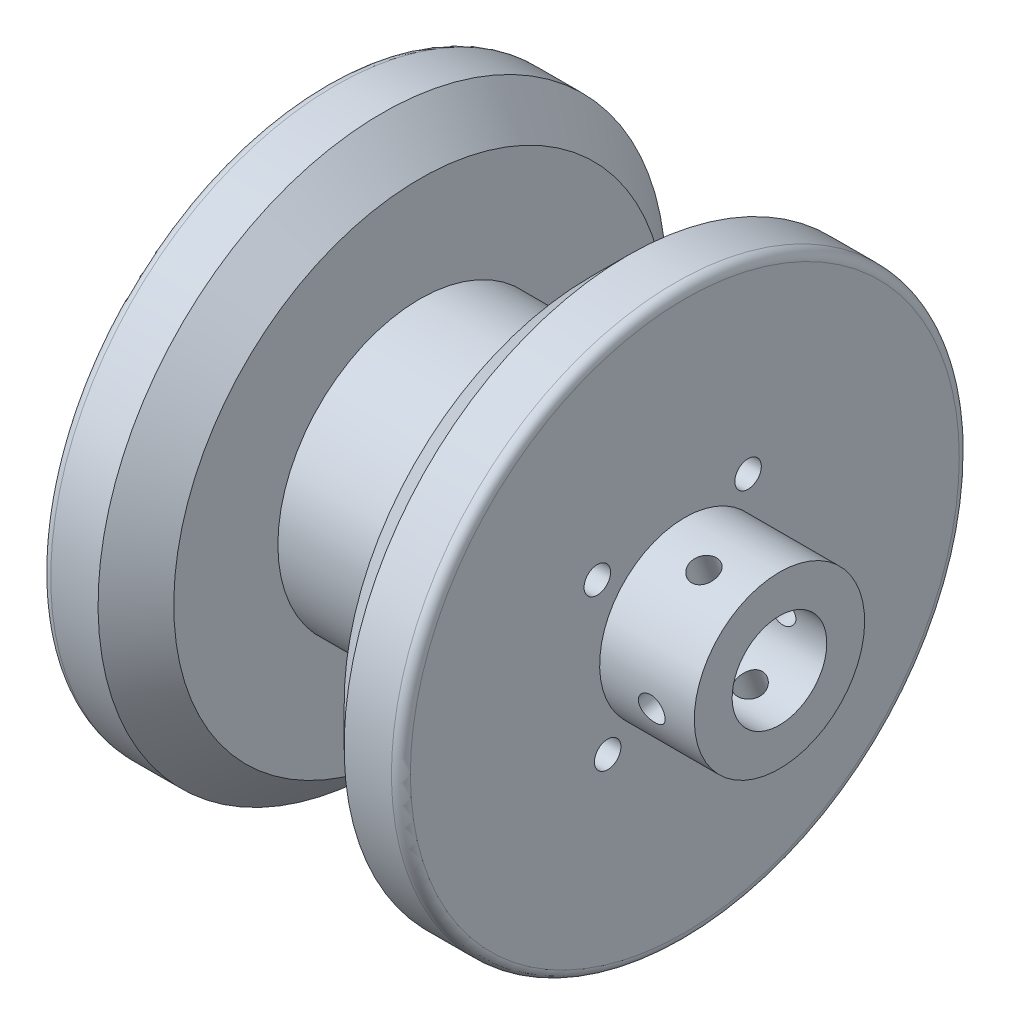
from build123d import *

# Parameters (mm, degrees)
SKETCH2_R                           = 9
BOSS_EXTRUDE1_DEPTH                 = 10
SKETCH3_R                           = 5
CUT_EXTRUDE1_DEPTH                  = 65.062469512
F_1_0MM_DOWEL_HOLE1_D               = 2.8
F_1_0MM_DOWEL_HOLE1_DEPTH           = 33.158795133
F_1_0MM_DOWEL_HOLE1_TIP             = 0.841204867
F_1_0MM_DOWEL_HOLE1_ON_FACE_2_D     = 2.8
F_1_0MM_DOWEL_HOLE1_ON_FACE_2_DEPTH = 33.158795133
F_1_0MM_DOWEL_HOLE1_ON_FACE_2_TIP   = 0.841204867
CHAMFER1_SIZE                       = 4
FILLET4_R                           = 1
CUT_EXTRUDE2_DEPTH                  = 52.390660687
CUT_EXTRUDE2_DEPTH_BACK             = 52.390660687
SKETCH5_W                           = 0.1
SKETCH5_H                           = 54.545123527
F_1_0MM_DOWEL_HOLE2_AT_2_COUNT      = 2
F_1_0MM_DOWEL_HOLE2_AT_2_PITCH      = 17.915817011
F_1_0MM_DOWEL_HOLE2_AT_3_COUNT      = 2
F_1_0MM_DOWEL_HOLE2_AT_3_PITCH      = 23.513798967
F_1_0MM_DOWEL_HOLE2_AT_4_COUNT      = 2
F_1_0MM_DOWEL_HOLE2_AT_4_PITCH      = 16.022789911


with BuildPart() as part:
    # Sketch1 → Revolve1 (revolve)
    with BuildSketch(Plane.XY):
        Polygon((-19, 0), (19, 0), (19, 30), (9, 30), (9, 15), (-9, 15), (-9, 30), (-19, 30), align=None)
    revolve(axis=Axis((-19, 0, 0), (1, 0, 0)))

    # Sketch2 → Boss-Extrude1 (add)
    with BuildSketch(Plane(origin=(19, 0, 0), x_dir=(0, 0, -1), z_dir=(1, 0, 0))):
        Circle(SKETCH2_R)
    extrude(amount=BOSS_EXTRUDE1_DEPTH)

    # Sketch3 → Cut-Extrude1 (cut, through all)
    with BuildSketch(Plane(origin=(29, 0, 0), x_dir=(0, 0, -1), z_dir=(1, 0, 0))):
        Circle(SKETCH3_R)
    extrude(amount=-CUT_EXTRUDE1_DEPTH, mode=Mode.SUBTRACT)

    # Ø1.0mm Dowel Hole1
    with Locations(Plane(origin=(24.178674036, 8.421026655, 3.175895162), x_dir=(0, -0.352877240247, 0.935669628296), z_dir=(0, 0.935669628296, 0.352877240247))):
        with Locations((0, 0)):
            Hole(F_1_0MM_DOWEL_HOLE1_D / 2, depth=F_1_0MM_DOWEL_HOLE1_DEPTH)
            with Locations((0, 0, -(F_1_0MM_DOWEL_HOLE1_DEPTH + F_1_0MM_DOWEL_HOLE1_TIP / 2))):  # 118° drill point
                Cone(0, F_1_0MM_DOWEL_HOLE1_D / 2, F_1_0MM_DOWEL_HOLE1_TIP, mode=Mode.SUBTRACT)

    # Ø1.0mm Dowel Hole1 on face 2
    with Locations(Plane(origin=(24.391872748, 1.421607155, -8.887014859), x_dir=(0, -0.987446147696, -0.157956023626), z_dir=(0, 0.157956023626, -0.987446147696))):
        with Locations((0, 0)):
            Hole(F_1_0MM_DOWEL_HOLE1_ON_FACE_2_D / 2, depth=F_1_0MM_DOWEL_HOLE1_ON_FACE_2_DEPTH)
            with Locations((0, 0, -(F_1_0MM_DOWEL_HOLE1_ON_FACE_2_DEPTH + F_1_0MM_DOWEL_HOLE1_ON_FACE_2_TIP / 2))):  # 118° drill point
                Cone(0, F_1_0MM_DOWEL_HOLE1_ON_FACE_2_D / 2, F_1_0MM_DOWEL_HOLE1_ON_FACE_2_TIP, mode=Mode.SUBTRACT)

    # Chamfer1
    chamfer1_edges = [part.edges().sort_by_distance(p)[0] for p in [
        (9, -30, 0),
        (-9, -30, 0),
    ]]
    chamfer(chamfer1_edges, length=CHAMFER1_SIZE)

    # Fillet4
    fillet4_edges = [part.edges().sort_by_distance(p)[0] for p in [
        (19, -30, 0),
        (-19, -30, 0),
    ]]
    fillet(fillet4_edges, radius=FILLET4_R)

    # Sketch5 → Cut-Extrude2 (cut, two sides: drawn at the far end of the back side and taken through both)
    with BuildSketch(Plane.XY.offset(-CUT_EXTRUDE2_DEPTH_BACK)):
        with Locations((8.95, -1.784186284)):
            Rectangle(SKETCH5_W, SKETCH5_H)
    extrude(amount=CUT_EXTRUDE2_DEPTH + CUT_EXTRUDE2_DEPTH_BACK, mode=Mode.SUBTRACT)


with BuildPart() as cut_extrude2_piece_1:
    # of the separate pieces the step leaves, piece 1, a body of its own (cut_extrude2_pieces)
    add(part.part.solids().sort_by_distance((8.9, 15, 0))[0])


with BuildPart() as cut_extrude2_piece_2:
    # of the separate pieces the step leaves, piece 2, a body of its own (cut_extrude2_pieces)
    add(part.part.solids().sort_by_distance((18, 30, 0))[0])


with BuildPart() as f_1_0mm_dowel_hole2_tool:
    # Sketch7 → Ø1.0mm Dowel Hole2 (revolve)
    with BuildSketch(Plane(origin=(19, 9.643598137, -6.682609189), x_dir=(0, 0, -1), z_dir=(0, 1, 0))):
        Polygon((0, 0), (0, 20), (1.4, 19.158795133), (1.4, 0), align=None)
    f_1_0mm_dowel_hole2 = revolve(axis=Axis((25.35, 9.643598137, -6.682609189), (-1, 0, 0)))


with BuildPart() as cut_extrude2_piece_1_1:
    add(cut_extrude2_piece_1.part)

    # Ø1.0mm Dowel Hole2: cut by f_1_0mm_dowel_hole2_tool
    add(f_1_0mm_dowel_hole2_tool.part, mode=Mode.SUBTRACT)


with BuildPart() as cut_extrude2_piece_2_1:
    add(cut_extrude2_piece_2.part)

    # Ø1.0mm Dowel Hole2: cut by f_1_0mm_dowel_hole2_tool
    add(f_1_0mm_dowel_hole2_tool.part, mode=Mode.SUBTRACT)


with BuildPart() as f_1_0mm_dowel_hole2_at_2_tool:
    # Ø1.0mm Dowel Hole2 at 2: Ø1.0mm Dowel Hole2 ×2
    with Locations(*[Vector(0, -0.9936686679053371, -0.11235024887926552) * (i * F_1_0MM_DOWEL_HOLE2_AT_2_PITCH) for i in range(1, F_1_0MM_DOWEL_HOLE2_AT_2_COUNT)]):
        add(f_1_0mm_dowel_hole2)


with BuildPart() as cut_extrude2_piece_1_2:
    add(cut_extrude2_piece_1_1.part)

    # Ø1.0mm Dowel Hole2 at 2: cut by f_1_0mm_dowel_hole2_at_2_tool
    add(f_1_0mm_dowel_hole2_at_2_tool.part, mode=Mode.SUBTRACT)


with BuildPart() as cut_extrude2_piece_2_2:
    add(cut_extrude2_piece_2_1.part)

    # Ø1.0mm Dowel Hole2 at 2: cut by f_1_0mm_dowel_hole2_at_2_tool
    add(f_1_0mm_dowel_hole2_at_2_tool.part, mode=Mode.SUBTRACT)


with BuildPart() as f_1_0mm_dowel_hole2_at_3_tool:
    # Ø1.0mm Dowel Hole2 at 3: Ø1.0mm Dowel Hole2 ×2
    with Locations(*[Vector(0, -0.7759335391269709, 0.6308146660136348) * (i * F_1_0MM_DOWEL_HOLE2_AT_3_PITCH) for i in range(1, F_1_0MM_DOWEL_HOLE2_AT_3_COUNT)]):
        add(f_1_0mm_dowel_hole2)


with BuildPart() as cut_extrude2_piece_1_3:
    add(cut_extrude2_piece_1_2.part)

    # Ø1.0mm Dowel Hole2 at 3: cut by f_1_0mm_dowel_hole2_at_3_tool
    add(f_1_0mm_dowel_hole2_at_3_tool.part, mode=Mode.SUBTRACT)


with BuildPart() as cut_extrude2_piece_2_3:
    add(cut_extrude2_piece_2_2.part)

    # Ø1.0mm Dowel Hole2 at 3: cut by f_1_0mm_dowel_hole2_at_3_tool
    add(f_1_0mm_dowel_hole2_at_3_tool.part, mode=Mode.SUBTRACT)


with BuildPart() as f_1_0mm_dowel_hole2_at_4_tool:
    # Ø1.0mm Dowel Hole2 at 4: Ø1.0mm Dowel Hole2 ×2
    with Locations(*[Vector(0, -0.1078235674903082, 0.9941700449589411) * (i * F_1_0MM_DOWEL_HOLE2_AT_4_PITCH) for i in range(1, F_1_0MM_DOWEL_HOLE2_AT_4_COUNT)]):
        add(f_1_0mm_dowel_hole2)


with BuildPart() as cut_extrude2_piece_1_4:
    add(cut_extrude2_piece_1_3.part)

    # Ø1.0mm Dowel Hole2 at 4: cut by f_1_0mm_dowel_hole2_at_4_tool
    add(f_1_0mm_dowel_hole2_at_4_tool.part, mode=Mode.SUBTRACT)


with BuildPart() as cut_extrude2_piece_2_4:
    add(cut_extrude2_piece_2_3.part)

    # Ø1.0mm Dowel Hole2 at 4: cut by f_1_0mm_dowel_hole2_at_4_tool
    add(f_1_0mm_dowel_hole2_at_4_tool.part, mode=Mode.SUBTRACT)


solid = Compound([cut_extrude2_piece_1_4.part, cut_extrude2_piece_2_4.part])
